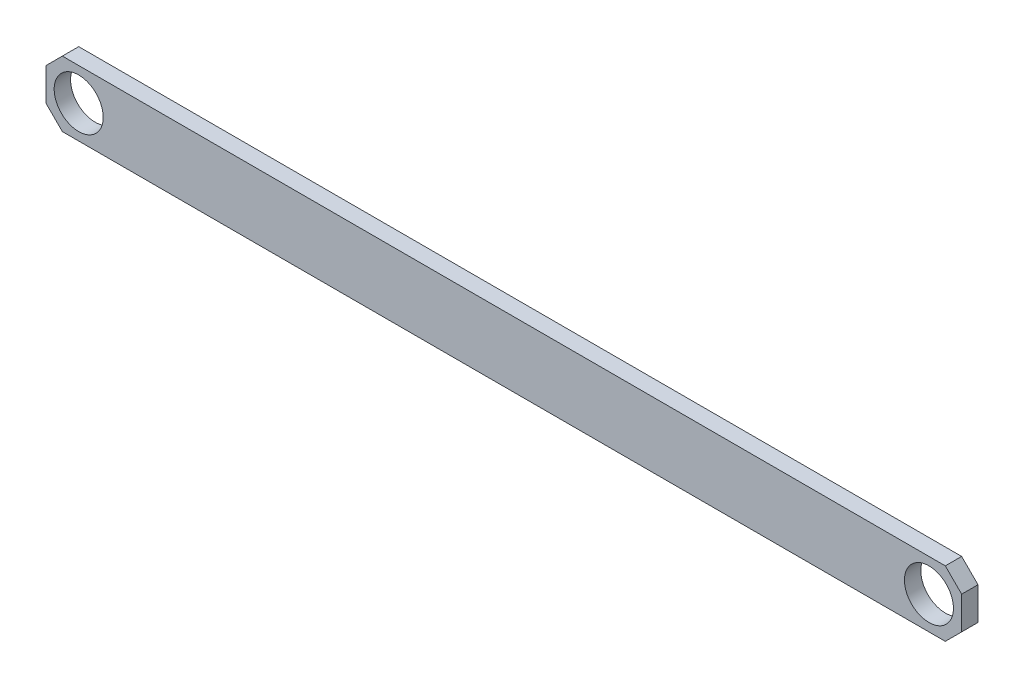
from build123d import *

# Parameters (mm, degrees)
SKETCH1_W          = 177.8
SKETCH1_H          = 12.7
SKETCH1_R          = 4.7625
BASE_EXTRUDE_DEPTH = 3.175
CHAMFER1_SIZE      = 3.175


with BuildPart() as part:
    # Sketch1 → Base-Extrude (new body)
    with BuildSketch(Plane.XY):
        with Locations((88.9, 6.35)):
            Rectangle(SKETCH1_W, SKETCH1_H)
        with Locations((6.35, 6.35)):
            Circle(SKETCH1_R, mode=Mode.SUBTRACT)
        with Locations((171.45, 6.35)):
            Circle(SKETCH1_R, mode=Mode.SUBTRACT)
    extrude(amount=BASE_EXTRUDE_DEPTH)

    # Chamfer1
    chamfer1_edges = [part.edges().sort_by_distance(p)[0] for p in [
        (0, 12.7, 1.5875),
        (0, 0, 1.5875),
        (177.8, 0, 1.5875),
        (177.8, 12.7, 1.5875),
    ]]
    chamfer(chamfer1_edges, length=CHAMFER1_SIZE)


solid = part.part
